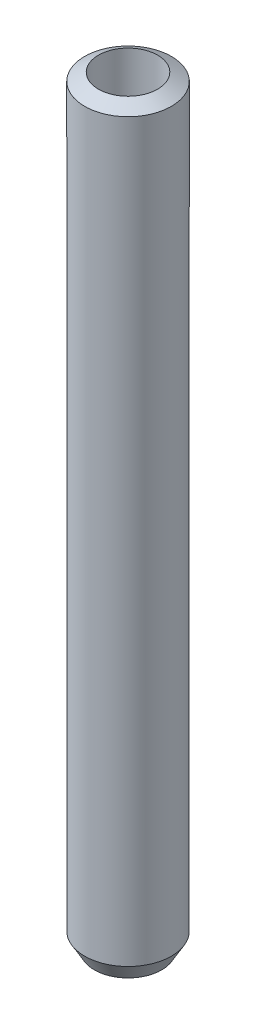
from build123d import *

# Parameters (mm, degrees)
SKETCH1_R           = 22.5
BOSS_EXTRUDE1_DEPTH = 395.81214
SKETCH2_R           = 15.346447484
CUT_EXTRUDE1_DEPTH  = 398.089096012
CHAMFER1_SIZE       = 5.028996
CHAMFER1_SIZE_2     = 8.710477


with BuildPart() as part:
    # Sketch1 → Boss-Extrude1 (new body)
    with BuildSketch(Plane(origin=(0, 0, 0), x_dir=(1, 0, 0), z_dir=(0, 1, 0))):
        with Locations(Location((0, 0, 0), (0, 0, 90))):
            Circle(SKETCH1_R)
    extrude(amount=BOSS_EXTRUDE1_DEPTH)

    # Sketch2 → Cut-Extrude1 (cut, through all)
    with BuildSketch(Plane(origin=(0, 0, 0), x_dir=(1, 0, 0), z_dir=(0, 1, 0))):
        with Locations(Location((0, 0, 0), (0, 0, 90))):
            Circle(SKETCH2_R)
    extrude(amount=CUT_EXTRUDE1_DEPTH, mode=Mode.SUBTRACT)

    # Chamfer1
    # the kernel refuses this chamfer: 8.710477, 5.028996 mm, written as the material it takes off along each edge
    with BuildSketch(Plane(origin=(0, 395.81214, 0), x_dir=(0, 0, -1), z_dir=(1, 0, 0))) as chamfer1_piece_1:
        Polygon((22.5, -CHAMFER1_SIZE), (22.5 - CHAMFER1_SIZE_2, 0), (22.5, 0), align=None)
    revolve(axis=Axis((0, 395.81214, 0), (0, 1, 0)), mode=Mode.SUBTRACT)
    with BuildSketch(Plane(origin=(0, 0, 0), x_dir=(0, 0, -1), z_dir=(1, 0, 0))) as chamfer1_piece_2:
        Polygon((22.5, CHAMFER1_SIZE_2), (22.5 - CHAMFER1_SIZE, 0), (22.5, 0), align=None)
    revolve(axis=Axis((0, 0, 0), (0, 1, 0)), mode=Mode.SUBTRACT)


solid = part.part
